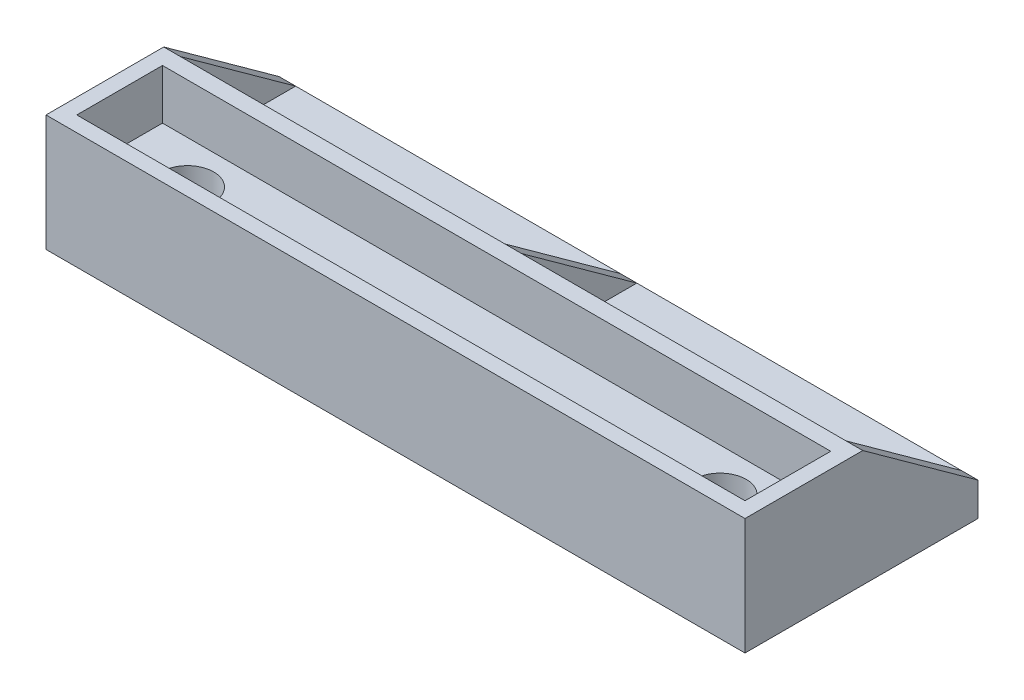
from build123d import *

# Parameters (mm, degrees)
SKETCH1_W               = 42
SKETCH1_H               = 7
RISER_DEPTH             = 7
SKETCH2_R               = 1.575
MOUNTING_HOLES_DEPTH    = 44.150898021
SKETCH3_W               = 40.15
SKETCH3_H               = 5.15
RECESS_DEPTH            = 3
SKETCH4_W               = 42
SKETCH4_H               = 7
FLANGE_DEPTH            = 7
SKETCH5_W               = 19.5
SKETCH5_H               = 6.925
FLANGE_CUTOUT_DEPTH     = 5
ANGLE_CUTOUT_DEPTH      = 27.594172294
ANGLE_CUTOUT_DEPTH_BACK = 27.594172294
FLANGE_CHAMFER_1_SIZE   = 1
FLANGE_CHAMFER_2_SIZE   = 1


with BuildPart() as part:
    # Sketch1 → Riser (new body)
    with BuildSketch(Plane(origin=(0, 0, 0), x_dir=(1, 0, 0), z_dir=(0, 1, 0))):
        with Locations((21, 3.5)):
            Rectangle(SKETCH1_W, SKETCH1_H)
    extrude(amount=RISER_DEPTH)

    # Sketch2 → Mounting Holes (cut, through all)
    with BuildSketch(Plane.XZ):
        with Locations((5, -3.5)):
            Circle(SKETCH2_R)
        with Locations((37, -3.5)):
            Circle(SKETCH2_R)
    extrude(amount=-MOUNTING_HOLES_DEPTH, mode=Mode.SUBTRACT)

    # Sketch3 → Recess (cut)
    with BuildSketch(Plane(origin=(0, 7, 0), x_dir=(1, 0, 0), z_dir=(0, 1, 0))):
        with Locations((21, 3.5)):
            Rectangle(SKETCH3_W, SKETCH3_H)
    extrude(amount=-RECESS_DEPTH, mode=Mode.SUBTRACT)

    # Sketch4 → Flange (add)
    with BuildSketch(Plane(origin=(0, 0, 0), x_dir=(1, 0, 0), z_dir=(0, 1, 0))):
        with Locations((21, 10.5)):
            Rectangle(SKETCH4_W, SKETCH4_H)
    extrude(amount=FLANGE_DEPTH)

    # Sketch5 → Flange Cutout (cut)
    with BuildSketch(Plane(origin=(0, 7, 0), x_dir=(1, 0, 0), z_dir=(0, 1, 0))):
        with Locations((10.75, 10.5375)):
            Rectangle(SKETCH5_W, SKETCH5_H)
        with Locations((31.25, 10.5375)):
            Rectangle(SKETCH5_W, SKETCH5_H)
    extrude(amount=-FLANGE_CUTOUT_DEPTH, mode=Mode.SUBTRACT)

    # Sketch7 → Angle Cutout (cut, two sides: drawn at the far end of the back side and taken through both)
    with BuildSketch(Plane.ZY.offset(-20.5).offset(-ANGLE_CUTOUT_DEPTH_BACK)):
        Polygon((-7.075, 7), (-14, 2), (-14, 7), align=None)
    extrude(amount=ANGLE_CUTOUT_DEPTH + ANGLE_CUTOUT_DEPTH_BACK, mode=Mode.SUBTRACT)

    # Flange Chamfer 1
    flange_chamfer_1_edges = [part.edges().sort_by_distance(p)[0] for p in [
        (10.75, 2, -7.075),
    ]]
    chamfer(flange_chamfer_1_edges, length=FLANGE_CHAMFER_1_SIZE)

    # Flange Chamfer 2
    flange_chamfer_2_edges = [part.edges().sort_by_distance(p)[0] for p in [
        (31.25, 2, -7.075),
    ]]
    chamfer(flange_chamfer_2_edges, length=FLANGE_CHAMFER_2_SIZE)


solid = part.part
